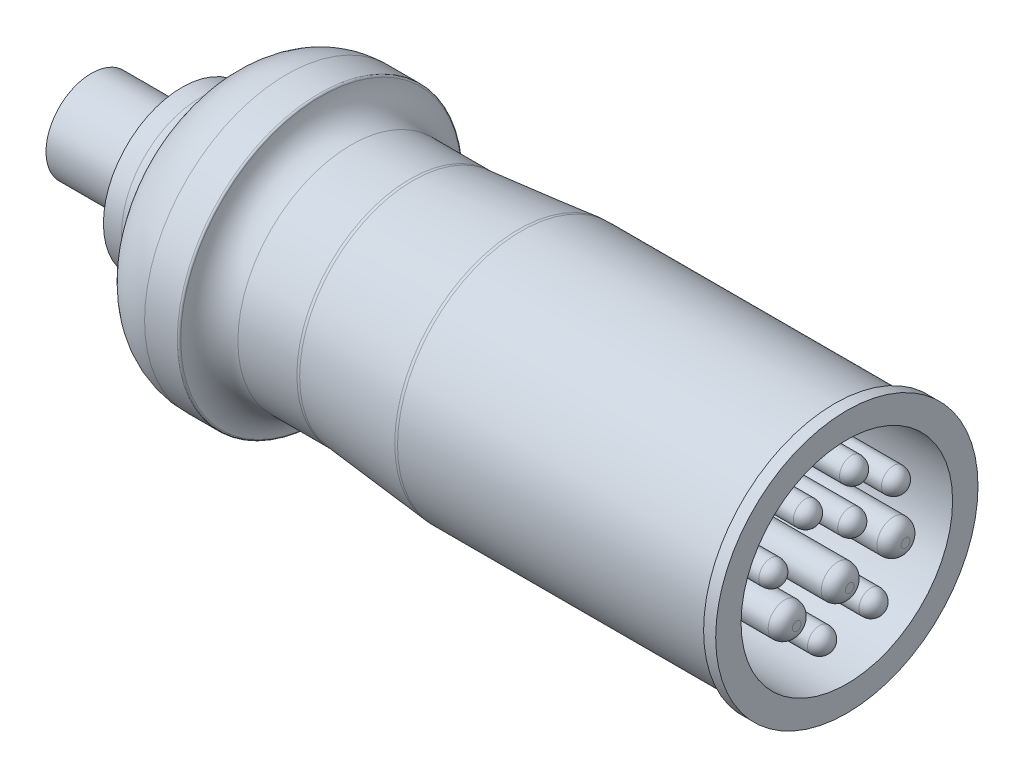
from build123d import *

# Parameters (mm, degrees)
FILLET1_R           = 5
FILLET2_R           = 0.3
FILLET3_R           = 5
SKETCH4_R           = 17.500000000000004
CUT_EXTRUDE1_DEPTH  = 35
SKETCH5_R           = 2.0006066698857174
SKETCH5_R_2         = 2.0006066698857157
SKETCH5_R_3         = 2.000606669885716
SKETCH5_R_4         = 2.733173099565215
BOSS_EXTRUDE1_DEPTH = 35
FILLET4_R           = 2
BOSS_EXTRUDE2_START = -2
SKETCH6_R           = 21.7
SKETCH6_R_2         = 20.5
BOSS_EXTRUDE2_DEPTH = 2
SKETCH7_R           = 7.5
SKETCH7_R_2         = 7
EXTRUDE_THIN1_DEPTH = 15


with BuildPart() as part:
    # Sketch3 → Revolve1 (revolve)
    with BuildSketch(Plane.XY, mode=Mode.PRIVATE) as revolve1_sk:
        with BuildLine():
            Line((65, 0), (65, 20.5))
            Line((65, 20.5), (10.914728577346645, 20.499999999999993))
            Line((10.914728577346645, 20.499999999999993), (-6.999999999999965, 18.75))
            Line((-6.999999999999965, 18.75), (-21.999999999999996, 18.749999999999993))
            Line((-21.999999999999996, 18.749999999999993), (-21.999999999999996, 23.5))
            Line((-21.999999999999996, 23.5), (-27.690911978745813, 23.5))
            ThreePointArc((-27.690911978745813, 23.5), (-34.19859974015539, 21.368483523128404), (-38.18424319433221, 15.800000000000004))
            ThreePointArc((-38.18424319433221, 15.800000000000004), (-39.63356808676015, 13.775096900680587), (-41.99999999999999, 13.000000000000009))
            Line((-41.99999999999999, 13.000000000000009), (-45, 13.000000000000004))
            Line((-45, 13.000000000000004), (-45, 0))
            Line((-45, 0), (-41.99999999999999, 0))
            Line((-41.99999999999999, 0), (65, 0))
        make_face()
    revolve(revolve1_sk.sketch.rotate(Axis((0, 0, 0), (1, 0, 0)), 90), axis=Axis((0, 0, 0), (1, 0, 0)))

    # Fillet1
    # the kernel refuses this fillet: 5 mm, written as the material it adds along each edge
    with BuildSketch(Plane(origin=(-21.999999999999996, 0, 0), x_dir=(0, 1.1e-16, 1), z_dir=(0, 1, -1.1e-16))) as fillet1_piece_1:
        with BuildLine():
            CenterArc((23.75, 4.993746088859545), FILLET1_R, 180, 87.13401601740111)
            Line((23.5, 0), (23.495, -0.09987492177718948))
            ThreePointArc((23.495, -0.09987492177718948), (21.124999999999996, -0.10000000000000142), (18.749999999999993, -0.10000000000000142))
            Line((18.749999999999993, -0.10000000000000142), (18.64999999999999, 0))
            Line((18.64999999999999, 0), (18.65, 4.993746088859545))
            Line((18.65, 4.993746088859545), (18.75, 4.993746088859545))
        make_face()
    revolve(axis=Axis((-21.999999999999996, 0, 0), (1, 0, 0)))

    # Fillet2
    fillet2_edges = [part.edges().sort_by_distance(p)[0] for p in [
        (-21.999999999999996, 4.95e-15, -23.5),
    ]]
    fillet(fillet2_edges, radius=FILLET2_R)

    # Fillet3
    # the kernel refuses this fillet: 5 mm, written as the material it adds along each edge
    with BuildSketch(Plane(origin=(-6.999999999999965, 0, 0), x_dir=(0, 1.1e-16, 1), z_dir=(0, 1, -1.1e-16))) as fillet3_piece_1:
        with BuildLine():
            CenterArc((18.75 + FILLET3_R, -FILLET3_R * 0.0487265272305), FILLET3_R, 174.42076403235384, 5.579235967646127)
            Line((18.75 + FILLET3_R * 0.00473730125852, FILLET3_R * 0.0484956949917), (18.75, 0))
            Line((18.75, 0), (18.75, -FILLET3_R * 0.0487265272305))
        make_face()
    revolve(axis=Axis((-6.999999999999965, 0, 0), (1, 0, 0)))
    # the kernel refuses this fillet: 5 mm, written as the material it takes off along each edge
    with BuildSketch(Plane(origin=(10.914728577346645, 0, 0), x_dir=(0, 1.1e-16, 1), z_dir=(0, 1, -1.1e-16))) as fillet3_2_piece_1:
        with BuildLine():
            CenterArc((20.499999999999993 - FILLET3_R, FILLET3_R * 0.0487265272305), FILLET3_R, 354.4207640323539, 5.579235967646187)
            Line((20.499999999999993, FILLET3_R * 0.0487265272305), (20.499999999999993, 0))
            Line((20.499999999999993, 0), (20.499999999999993 - FILLET3_R * 0.00473730125852, -FILLET3_R * 0.0484956949917))
        make_face()
    revolve(axis=Axis((10.914728577346645, 0, 0), (1, 0, 0)), mode=Mode.SUBTRACT)

    # Sketch4 → Cut-Extrude1 (cut)
    with BuildSketch(Plane(origin=(65, 0, 0), x_dir=(0, 0, -1), z_dir=(1, 0, 0))):
        Circle(SKETCH4_R)
    extrude(amount=-CUT_EXTRUDE1_DEPTH, mode=Mode.SUBTRACT)

    # Sketch5 → Boss-Extrude1 (add)
    with BuildSketch(Plane(origin=(30, 0, 0), x_dir=(0, 0, -1), z_dir=(1, 0, 0))):
        with Locations(Location((2.4851998621818705, 3.5673165613128455, 0), (0, 0, 180))):
            Circle(SKETCH5_R)
        with Locations(Location((2.784475529300205, 10.869395236751556, 0), (0, 0, 180))):
            Circle(SKETCH5_R_2)
        with Locations(Location((-4.843943845783035, 8.444175204210639, 0), (0, 0, 180))):
            Circle(SKETCH5_R)
        with Locations(Location((-10.576282104516107, 2.8441216745252547, 0), (0, 0, 180))):
            Circle(SKETCH5_R_3)
        with Locations(Location((9.707376349462452, 5.930765352304601, 0), (0, 0, 180))):
            Circle(SKETCH5_R_3)
        with Locations(Location((-2.5069136326072483, -10.869395236751556, 0), (0, 0, 180))):
            Circle(SKETCH5_R)
        with Locations(Location((6.003403936127238, -9.722927585004939, 0), (0, 0, 180))):
            Circle(SKETCH5_R)
        with Locations(Location((9.707376349462452, -2.1386031196042588, 0), (0, 0, 180))):
            Circle(SKETCH5_R_4)
        with Locations(Location((0.49154022580697854, -3.990589326271869, 0), (0, 0, 180))):
            Circle(SKETCH5_R_4)
        with Locations(Location((-8.28334680102288, -5.048867158653359, 0), (0, 0, 180))):
            Circle(SKETCH5_R_4)
    extrude(amount=BOSS_EXTRUDE1_DEPTH)

    # Fillet4
    fillet4_edges = [part.edges().sort_by_distance(p)[0] for p in [
        (65, 3.567316561312845, -4.485806532067588),
        (65, 10.869395236751556, -4.78508219918592),
        (65, 8.444175204210639, 2.8433371758973176),
        (65, 2.844121674525254, 8.57567543463039),
        (65, 5.9307653523046, -11.707983019348168),
        (65, -10.869395236751556, 0.5063069627215309),
        (65, -9.722927585004939, -8.004010606012956),
        (65, -2.1386031196042583, -12.440549449027667),
        (65, -3.9905893262718686, -3.2247133253721936),
        (65, -5.0488671586533584, 5.550173701457664),
    ]]
    fillet(fillet4_edges, radius=FILLET4_R)

    # Sketch6 → Boss-Extrude2 (add)
    with BuildSketch(Plane(origin=(65, 0, 0), x_dir=(0, 0, -1), z_dir=(1, 0, 0)).offset(BOSS_EXTRUDE2_START)):
        Circle(SKETCH6_R)
        Circle(SKETCH6_R_2, mode=Mode.SUBTRACT)
    extrude(amount=BOSS_EXTRUDE2_DEPTH)

    # Sketch7 → Extrude-Thin1 (add)
    with BuildSketch(Plane.ZY.offset(45)):
        Circle(SKETCH7_R)
        Circle(SKETCH7_R_2, mode=Mode.SUBTRACT)
    extrude(amount=EXTRUDE_THIN1_DEPTH)


solid = part.part
